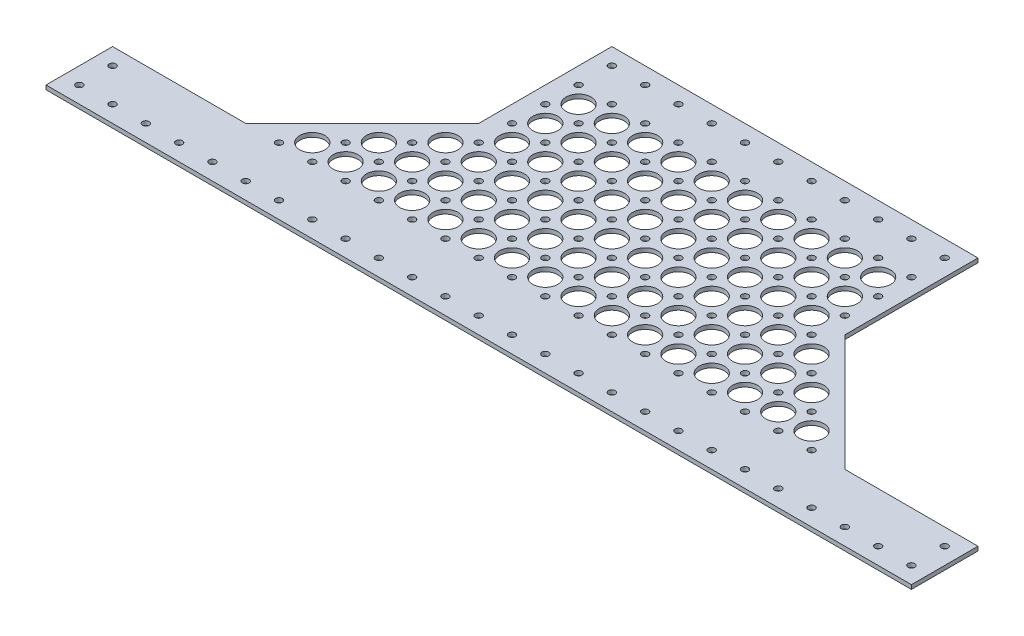
from build123d import *

# Parameters (mm, degrees)
SKETCH1_R           = 2.54
BOSS_EXTRUDE1_DEPTH = 3.175
SKETCH2_W           = 711.2
SKETCH2_H           = 25.4
CUT_EXTRUDE2_DEPTH  = 469.9
CUT_EXTRUDE3_START  = -3.175
SKETCH3_R           = 2.54
SKETCH3_R_2         = 9.525
CUT_EXTRUDE3_DEPTH  = 3.175


with BuildPart() as part:
    # Sketch1 → Boss-Extrude1 (new body)
    with BuildSketch(Plane(origin=(0, 0, 0), x_dir=(1, 0, 0), z_dir=(0, 1, 0))):
        Polygon((0, 101.6), (0, 0), (-88.904535599, -88.904535599), (-177.804535599, -88.904535599), (-190.504535599, -88.904535599), (-190.504535599, -419.104535599), (-177.804535599, -419.104535599), (-88.904535599, -419.104535599), (0, -508.009071197), (0, -609.609071197), (279.4, -609.609071197), (279.4, -508.009071197), (368.304535599, -419.104535599), (469.904535599, -419.104535599), (469.904535599, -88.904535599), (368.304535599, -88.904535599), (279.4, 0), (279.4, 101.6), align=None)
        with Locations((12.7, -596.909071197)):
            Circle(SKETCH1_R, mode=Mode.SUBTRACT)
        with Locations((38.1, -596.909071197)):
            Circle(SKETCH1_R, mode=Mode.SUBTRACT)
        with Locations((63.5, -596.909071197)):
            Circle(SKETCH1_R, mode=Mode.SUBTRACT)
        with Locations((88.9, -596.909071197)):
            Circle(SKETCH1_R, mode=Mode.SUBTRACT)
        with Locations((114.3, -596.909071197)):
            Circle(SKETCH1_R, mode=Mode.SUBTRACT)
        with Locations((139.7, -596.909071197)):
            Circle(SKETCH1_R, mode=Mode.SUBTRACT)
        with Locations((-177.804535599, -406.404535599)):
            Circle(SKETCH1_R, mode=Mode.SUBTRACT)
        with Locations((-152.404535599, -406.404535599)):
            Circle(SKETCH1_R, mode=Mode.SUBTRACT)
        with Locations((-127.004535599, -406.404535599)):
            Circle(SKETCH1_R, mode=Mode.SUBTRACT)
        with Locations((-177.804535599, -381.004535599)):
            Circle(SKETCH1_R, mode=Mode.SUBTRACT)
        with Locations((-152.404535599, -381.004535599)):
            Circle(SKETCH1_R, mode=Mode.SUBTRACT)
        with Locations((-177.804535599, -355.604535599)):
            Circle(SKETCH1_R, mode=Mode.SUBTRACT)
        with Locations((-127.004535599, -381.004535599)):
            Circle(SKETCH1_R, mode=Mode.SUBTRACT)
        with Locations((-101.604535599, -406.404535599)):
            Circle(SKETCH1_R, mode=Mode.SUBTRACT)
        with Locations((-101.604535599, -381.004535599)):
            Circle(SKETCH1_R, mode=Mode.SUBTRACT)
        with Locations((-177.804535599, -330.204535599)):
            Circle(SKETCH1_R, mode=Mode.SUBTRACT)
        with Locations((-177.804535599, -304.804535599)):
            Circle(SKETCH1_R, mode=Mode.SUBTRACT)
        with Locations((-177.804535599, -279.404535599)):
            Circle(SKETCH1_R, mode=Mode.SUBTRACT)
        with Locations((165.1, -596.909071197)):
            Circle(SKETCH1_R, mode=Mode.SUBTRACT)
        with Locations((190.5, -596.909071197)):
            Circle(SKETCH1_R, mode=Mode.SUBTRACT)
        with Locations((215.9, -596.909071197)):
            Circle(SKETCH1_R, mode=Mode.SUBTRACT)
        with Locations((241.3, -596.909071197)):
            Circle(SKETCH1_R, mode=Mode.SUBTRACT)
        with Locations((266.7, -596.909071197)):
            Circle(SKETCH1_R, mode=Mode.SUBTRACT)
        with Locations((381.004535599, -406.404535599)):
            Circle(SKETCH1_R, mode=Mode.SUBTRACT)
        with Locations((381.004535599, -381.004535599)):
            Circle(SKETCH1_R, mode=Mode.SUBTRACT)
        with Locations((406.404535599, -406.404535599)):
            Circle(SKETCH1_R, mode=Mode.SUBTRACT)
        with Locations((431.804535599, -406.404535599)):
            Circle(SKETCH1_R, mode=Mode.SUBTRACT)
        with Locations((457.204535599, -406.404535599)):
            Circle(SKETCH1_R, mode=Mode.SUBTRACT)
        with Locations((406.404535599, -381.004535599)):
            Circle(SKETCH1_R, mode=Mode.SUBTRACT)
        with Locations((431.804535599, -381.004535599)):
            Circle(SKETCH1_R, mode=Mode.SUBTRACT)
        with Locations((457.204535599, -381.004535599)):
            Circle(SKETCH1_R, mode=Mode.SUBTRACT)
        with Locations((457.204535599, -355.604535599)):
            Circle(SKETCH1_R, mode=Mode.SUBTRACT)
        with Locations((457.204535599, -330.204535599)):
            Circle(SKETCH1_R, mode=Mode.SUBTRACT)
        with Locations((457.204535599, -304.804535599)):
            Circle(SKETCH1_R, mode=Mode.SUBTRACT)
        with Locations((457.204535599, -279.404535599)):
            Circle(SKETCH1_R, mode=Mode.SUBTRACT)
        with Locations((-177.804535599, -254.004535599)):
            Circle(SKETCH1_R, mode=Mode.SUBTRACT)
        with Locations((-177.804535599, -228.604535599)):
            Circle(SKETCH1_R, mode=Mode.SUBTRACT)
        with Locations((-177.804535599, -203.204535599)):
            Circle(SKETCH1_R, mode=Mode.SUBTRACT)
        with Locations((-177.804535599, -177.804535599)):
            Circle(SKETCH1_R, mode=Mode.SUBTRACT)
        with Locations((-177.804535599, -152.404535599)):
            Circle(SKETCH1_R, mode=Mode.SUBTRACT)
        with Locations((-152.404535599, -152.404535599)):
            Circle(SKETCH1_R, mode=Mode.SUBTRACT)
        with Locations((-177.804535599, -127.004535599)):
            Circle(SKETCH1_R, mode=Mode.SUBTRACT)
        with Locations((-152.404535599, -127.004535599)):
            Circle(SKETCH1_R, mode=Mode.SUBTRACT)
        with Locations((-127.004535599, -152.404535599)):
            Circle(SKETCH1_R, mode=Mode.SUBTRACT)
        with Locations((-127.004535599, -127.004535599)):
            Circle(SKETCH1_R, mode=Mode.SUBTRACT)
        with Locations((-177.804535599, -101.604535599)):
            Circle(SKETCH1_R, mode=Mode.SUBTRACT)
        with Locations((-101.604535599, -152.404535599)):
            Circle(SKETCH1_R, mode=Mode.SUBTRACT)
        with Locations((-76.204535599, -152.404535599)):
            Circle(SKETCH1_R, mode=Mode.SUBTRACT)
        with Locations((-101.604535599, -127.004535599)):
            Circle(SKETCH1_R, mode=Mode.SUBTRACT)
        with Locations((-76.204535599, -127.004535599)):
            Circle(SKETCH1_R, mode=Mode.SUBTRACT)
        with Locations((-50.804535599, -152.404535599)):
            Circle(SKETCH1_R, mode=Mode.SUBTRACT)
        with Locations((-25.404535599, -152.404535599)):
            Circle(SKETCH1_R, mode=Mode.SUBTRACT)
        with Locations((-50.804535599, -127.004535599)):
            Circle(SKETCH1_R, mode=Mode.SUBTRACT)
        with Locations((-25.404535599, -127.004535599)):
            Circle(SKETCH1_R, mode=Mode.SUBTRACT)
        with Locations((-0.004535599, -152.404535599)):
            Circle(SKETCH1_R, mode=Mode.SUBTRACT)
        with Locations((-0.004535599, -127.004535599)):
            Circle(SKETCH1_R, mode=Mode.SUBTRACT)
        with Locations((25.395464401, -152.404535599)):
            Circle(SKETCH1_R, mode=Mode.SUBTRACT)
        with Locations((50.795464401, -152.404535599)):
            Circle(SKETCH1_R, mode=Mode.SUBTRACT)
        with Locations((25.395464401, -127.004535599)):
            Circle(SKETCH1_R, mode=Mode.SUBTRACT)
        with Locations((50.795464401, -127.004535599)):
            Circle(SKETCH1_R, mode=Mode.SUBTRACT)
        with Locations((76.195464401, -152.404535599)):
            Circle(SKETCH1_R, mode=Mode.SUBTRACT)
        with Locations((76.195464401, -127.004535599)):
            Circle(SKETCH1_R, mode=Mode.SUBTRACT)
        with Locations((101.595464401, -152.404535599)):
            Circle(SKETCH1_R, mode=Mode.SUBTRACT)
        with Locations((126.995464401, -152.404535599)):
            Circle(SKETCH1_R, mode=Mode.SUBTRACT)
        with Locations((101.595464401, -127.004535599)):
            Circle(SKETCH1_R, mode=Mode.SUBTRACT)
        with Locations((126.995464401, -127.004535599)):
            Circle(SKETCH1_R, mode=Mode.SUBTRACT)
        with Locations((12.7, 88.9)):
            Circle(SKETCH1_R, mode=Mode.SUBTRACT)
        with Locations((38.1, 88.9)):
            Circle(SKETCH1_R, mode=Mode.SUBTRACT)
        with Locations((63.5, 88.9)):
            Circle(SKETCH1_R, mode=Mode.SUBTRACT)
        with Locations((88.9, 88.9)):
            Circle(SKETCH1_R, mode=Mode.SUBTRACT)
        with Locations((114.3, 88.9)):
            Circle(SKETCH1_R, mode=Mode.SUBTRACT)
        with Locations((139.7, 88.9)):
            Circle(SKETCH1_R, mode=Mode.SUBTRACT)
        with Locations((152.395464401, -152.404535599)):
            Circle(SKETCH1_R, mode=Mode.SUBTRACT)
        with Locations((177.795464401, -152.404535599)):
            Circle(SKETCH1_R, mode=Mode.SUBTRACT)
        with Locations((152.395464401, -127.004535599)):
            Circle(SKETCH1_R, mode=Mode.SUBTRACT)
        with Locations((177.795464401, -127.004535599)):
            Circle(SKETCH1_R, mode=Mode.SUBTRACT)
        with Locations((203.195464401, -152.404535599)):
            Circle(SKETCH1_R, mode=Mode.SUBTRACT)
        with Locations((203.195464401, -127.004535599)):
            Circle(SKETCH1_R, mode=Mode.SUBTRACT)
        with Locations((228.595464401, -152.404535599)):
            Circle(SKETCH1_R, mode=Mode.SUBTRACT)
        with Locations((253.995464401, -152.404535599)):
            Circle(SKETCH1_R, mode=Mode.SUBTRACT)
        with Locations((228.595464401, -127.004535599)):
            Circle(SKETCH1_R, mode=Mode.SUBTRACT)
        with Locations((253.995464401, -127.004535599)):
            Circle(SKETCH1_R, mode=Mode.SUBTRACT)
        with Locations((279.395464401, -152.404535599)):
            Circle(SKETCH1_R, mode=Mode.SUBTRACT)
        with Locations((304.795464401, -152.404535599)):
            Circle(SKETCH1_R, mode=Mode.SUBTRACT)
        with Locations((279.395464401, -127.004535599)):
            Circle(SKETCH1_R, mode=Mode.SUBTRACT)
        with Locations((304.795464401, -127.004535599)):
            Circle(SKETCH1_R, mode=Mode.SUBTRACT)
        with Locations((457.204535599, -254.004535599)):
            Circle(SKETCH1_R, mode=Mode.SUBTRACT)
        with Locations((457.204535599, -228.604535599)):
            Circle(SKETCH1_R, mode=Mode.SUBTRACT)
        with Locations((457.204535599, -203.204535599)):
            Circle(SKETCH1_R, mode=Mode.SUBTRACT)
        with Locations((457.204535599, -177.804535599)):
            Circle(SKETCH1_R, mode=Mode.SUBTRACT)
        with Locations((330.195464401, -152.404535599)):
            Circle(SKETCH1_R, mode=Mode.SUBTRACT)
        with Locations((330.195464401, -127.004535599)):
            Circle(SKETCH1_R, mode=Mode.SUBTRACT)
        with Locations((355.595464401, -152.404535599)):
            Circle(SKETCH1_R, mode=Mode.SUBTRACT)
        with Locations((380.995464401, -152.404535599)):
            Circle(SKETCH1_R, mode=Mode.SUBTRACT)
        with Locations((355.595464401, -127.004535599)):
            Circle(SKETCH1_R, mode=Mode.SUBTRACT)
        with Locations((380.995464401, -127.004535599)):
            Circle(SKETCH1_R, mode=Mode.SUBTRACT)
        with Locations((406.395464401, -152.404535599)):
            Circle(SKETCH1_R, mode=Mode.SUBTRACT)
        with Locations((406.395464401, -127.004535599)):
            Circle(SKETCH1_R, mode=Mode.SUBTRACT)
        with Locations((431.795464401, -152.404535599)):
            Circle(SKETCH1_R, mode=Mode.SUBTRACT)
        with Locations((457.204535599, -152.404535599)):
            Circle(SKETCH1_R, mode=Mode.SUBTRACT)
        with Locations((431.795464401, -127.004535599)):
            Circle(SKETCH1_R, mode=Mode.SUBTRACT)
        with Locations((457.204535599, -127.004535599)):
            Circle(SKETCH1_R, mode=Mode.SUBTRACT)
        with Locations((457.204535599, -101.604535599)):
            Circle(SKETCH1_R, mode=Mode.SUBTRACT)
        with Locations((165.1, 88.9)):
            Circle(SKETCH1_R, mode=Mode.SUBTRACT)
        with Locations((190.5, 88.9)):
            Circle(SKETCH1_R, mode=Mode.SUBTRACT)
        with Locations((215.9, 88.9)):
            Circle(SKETCH1_R, mode=Mode.SUBTRACT)
        with Locations((241.3, 88.9)):
            Circle(SKETCH1_R, mode=Mode.SUBTRACT)
        with Locations((266.7, 88.9)):
            Circle(SKETCH1_R, mode=Mode.SUBTRACT)
    extrude(amount=BOSS_EXTRUDE1_DEPTH)

    # Sketch2 → Cut-Extrude2 (cut)
    with BuildSketch(Plane.XY.offset(609.609071197)):
        with Locations((152.586714342, 0)):
            Rectangle(SKETCH2_W, SKETCH2_H)
    extrude(amount=-CUT_EXTRUDE2_DEPTH, mode=Mode.SUBTRACT)

    # Sketch3 → Cut-Extrude3 (cut)
    with BuildSketch(Plane(origin=(0, 3.175, 0), x_dir=(1, 0, 0), z_dir=(0, 1, 0)).offset(CUT_EXTRUDE3_START)):
        with Locations((12.7, 88.9)):
            Circle(SKETCH3_R)
        with Locations((38.1, 88.9)):
            Circle(SKETCH3_R)
        with Locations((63.5, 88.9)):
            Circle(SKETCH3_R)
        with Locations((88.9, 88.9)):
            Circle(SKETCH3_R)
        with Locations((114.3, 88.9)):
            Circle(SKETCH3_R)
        with Locations((139.7, 88.9)):
            Circle(SKETCH3_R)
        with Locations((165.1, 88.9)):
            Circle(SKETCH3_R)
        with Locations((190.5, 88.9)):
            Circle(SKETCH3_R)
        with Locations((215.9, 88.9)):
            Circle(SKETCH3_R)
        with Locations((241.3, 88.9)):
            Circle(SKETCH3_R)
        with Locations((266.7, 88.9)):
            Circle(SKETCH3_R)
        with Locations((12.7, 63.5)):
            Circle(SKETCH3_R)
        with Locations((38.1, 63.5)):
            Circle(SKETCH3_R)
        with Locations((63.5, 63.5)):
            Circle(SKETCH3_R)
        with Locations((88.9, 63.5)):
            Circle(SKETCH3_R)
        with Locations((114.3, 63.5)):
            Circle(SKETCH3_R)
        with Locations((139.7, 63.5)):
            Circle(SKETCH3_R)
        with Locations((165.1, 63.5)):
            Circle(SKETCH3_R)
        with Locations((190.5, 63.5)):
            Circle(SKETCH3_R)
        with Locations((215.9, 63.5)):
            Circle(SKETCH3_R)
        with Locations((241.3, 63.5)):
            Circle(SKETCH3_R)
        with Locations((266.7, 63.5)):
            Circle(SKETCH3_R)
        with Locations((12.7, 38.1)):
            Circle(SKETCH3_R)
        with Locations((38.1, 38.1)):
            Circle(SKETCH3_R)
        with Locations((63.5, 38.1)):
            Circle(SKETCH3_R)
        with Locations((88.9, 38.1)):
            Circle(SKETCH3_R)
        with Locations((114.3, 38.1)):
            Circle(SKETCH3_R)
        with Locations((139.7, 38.1)):
            Circle(SKETCH3_R)
        with Locations((165.1, 38.1)):
            Circle(SKETCH3_R)
        with Locations((190.5, 38.1)):
            Circle(SKETCH3_R)
        with Locations((215.9, 38.1)):
            Circle(SKETCH3_R)
        with Locations((241.3, 38.1)):
            Circle(SKETCH3_R)
        with Locations((266.7, 38.1)):
            Circle(SKETCH3_R)
        with Locations((12.7, 12.7)):
            Circle(SKETCH3_R)
        with Locations((38.1, 12.7)):
            Circle(SKETCH3_R)
        with Locations((63.5, 12.7)):
            Circle(SKETCH3_R)
        with Locations((88.9, 12.7)):
            Circle(SKETCH3_R)
        with Locations((114.3, 12.7)):
            Circle(SKETCH3_R)
        with Locations((139.7, 12.7)):
            Circle(SKETCH3_R)
        with Locations((165.1, 12.7)):
            Circle(SKETCH3_R)
        with Locations((190.5, 12.7)):
            Circle(SKETCH3_R)
        with Locations((215.9, 12.7)):
            Circle(SKETCH3_R)
        with Locations((241.3, 12.7)):
            Circle(SKETCH3_R)
        with Locations((266.7, 12.7)):
            Circle(SKETCH3_R)
        with Locations((12.7, -12.7)):
            Circle(SKETCH3_R)
        with Locations((38.1, -12.7)):
            Circle(SKETCH3_R)
        with Locations((63.5, -12.7)):
            Circle(SKETCH3_R)
        with Locations((88.9, -12.7)):
            Circle(SKETCH3_R)
        with Locations((114.3, -12.7)):
            Circle(SKETCH3_R)
        with Locations((139.7, -12.7)):
            Circle(SKETCH3_R)
        with Locations((165.1, -12.7)):
            Circle(SKETCH3_R)
        with Locations((190.5, -12.7)):
            Circle(SKETCH3_R)
        with Locations((215.9, -12.7)):
            Circle(SKETCH3_R)
        with Locations((241.3, -12.7)):
            Circle(SKETCH3_R)
        with Locations((266.7, -12.7)):
            Circle(SKETCH3_R)
        with Locations((12.7, -38.1)):
            Circle(SKETCH3_R)
        with Locations((38.1, -38.1)):
            Circle(SKETCH3_R)
        with Locations((63.5, -38.1)):
            Circle(SKETCH3_R)
        with Locations((88.9, -38.1)):
            Circle(SKETCH3_R)
        with Locations((114.3, -38.1)):
            Circle(SKETCH3_R)
        with Locations((139.7, -38.1)):
            Circle(SKETCH3_R)
        with Locations((165.1, -38.1)):
            Circle(SKETCH3_R)
        with Locations((190.5, -38.1)):
            Circle(SKETCH3_R)
        with Locations((215.9, -38.1)):
            Circle(SKETCH3_R)
        with Locations((241.3, -38.1)):
            Circle(SKETCH3_R)
        with Locations((266.7, -38.1)):
            Circle(SKETCH3_R)
        with Locations((12.7, -63.5)):
            Circle(SKETCH3_R)
        with Locations((38.1, -63.5)):
            Circle(SKETCH3_R)
        with Locations((63.5, -63.5)):
            Circle(SKETCH3_R)
        with Locations((88.9, -63.5)):
            Circle(SKETCH3_R)
        with Locations((114.3, -63.5)):
            Circle(SKETCH3_R)
        with Locations((139.7, -63.5)):
            Circle(SKETCH3_R)
        with Locations((165.1, -63.5)):
            Circle(SKETCH3_R)
        with Locations((190.5, -63.5)):
            Circle(SKETCH3_R)
        with Locations((215.9, -63.5)):
            Circle(SKETCH3_R)
        with Locations((241.3, -63.5)):
            Circle(SKETCH3_R)
        with Locations((266.7, -63.5)):
            Circle(SKETCH3_R)
        with Locations((12.7, -88.9)):
            Circle(SKETCH3_R)
        with Locations((38.1, -88.9)):
            Circle(SKETCH3_R)
        with Locations((63.5, -88.9)):
            Circle(SKETCH3_R)
        with Locations((88.9, -88.9)):
            Circle(SKETCH3_R)
        with Locations((114.3, -88.9)):
            Circle(SKETCH3_R)
        with Locations((139.7, -88.9)):
            Circle(SKETCH3_R)
        with Locations((165.1, -88.9)):
            Circle(SKETCH3_R)
        with Locations((190.5, -88.9)):
            Circle(SKETCH3_R)
        with Locations((215.9, -88.9)):
            Circle(SKETCH3_R)
        with Locations((241.3, -88.9)):
            Circle(SKETCH3_R)
        with Locations((266.7, -88.9)):
            Circle(SKETCH3_R)
        with Locations((-12.7, -88.9)):
            Circle(SKETCH3_R)
        with Locations((-38.1, -88.9)):
            Circle(SKETCH3_R)
        with Locations((-63.5, -88.9)):
            Circle(SKETCH3_R)
        with Locations((-12.7, -63.5)):
            Circle(SKETCH3_R)
        with Locations((-38.1, -63.5)):
            Circle(SKETCH3_R)
        with Locations((-12.7, -38.1)):
            Circle(SKETCH3_R)
        with Locations((292.1, -88.9)):
            Circle(SKETCH3_R)
        with Locations((317.5, -88.9)):
            Circle(SKETCH3_R)
        with Locations((342.9, -88.9)):
            Circle(SKETCH3_R)
        with Locations((292.1, -63.5)):
            Circle(SKETCH3_R)
        with Locations((317.5, -63.5)):
            Circle(SKETCH3_R)
        with Locations((292.1, -38.1)):
            Circle(SKETCH3_R)
        with Locations((25.4, 50.8)):
            Circle(SKETCH3_R_2)
        with Locations((50.8, 50.8)):
            Circle(SKETCH3_R_2)
        with Locations((76.2, 50.8)):
            Circle(SKETCH3_R_2)
        with Locations((101.6, 50.8)):
            Circle(SKETCH3_R_2)
        with Locations((127, 50.8)):
            Circle(SKETCH3_R_2)
        with Locations((152.4, 50.8)):
            Circle(SKETCH3_R_2)
        with Locations((177.8, 50.8)):
            Circle(SKETCH3_R_2)
        with Locations((203.2, 50.8)):
            Circle(SKETCH3_R_2)
        with Locations((228.6, 50.8)):
            Circle(SKETCH3_R_2)
        with Locations((254, 50.8)):
            Circle(SKETCH3_R_2)
        with Locations((50.8, 25.4)):
            Circle(SKETCH3_R_2)
        with Locations((76.2, 25.4)):
            Circle(SKETCH3_R_2)
        with Locations((101.6, 25.4)):
            Circle(SKETCH3_R_2)
        with Locations((127, 25.4)):
            Circle(SKETCH3_R_2)
        with Locations((152.4, 25.4)):
            Circle(SKETCH3_R_2)
        with Locations((177.8, 25.4)):
            Circle(SKETCH3_R_2)
        with Locations((203.2, 25.4)):
            Circle(SKETCH3_R_2)
        with Locations((228.6, 25.4)):
            Circle(SKETCH3_R_2)
        with Locations((254, 25.4)):
            Circle(SKETCH3_R_2)
        with Locations((50.8, 0)):
            Circle(SKETCH3_R_2)
        with Locations((76.2, 0)):
            Circle(SKETCH3_R_2)
        with Locations((101.6, 0)):
            Circle(SKETCH3_R_2)
        with Locations((127, 0)):
            Circle(SKETCH3_R_2)
        with Locations((152.4, 0)):
            Circle(SKETCH3_R_2)
        with Locations((177.8, 0)):
            Circle(SKETCH3_R_2)
        with Locations((203.2, 0)):
            Circle(SKETCH3_R_2)
        with Locations((228.6, 0)):
            Circle(SKETCH3_R_2)
        with Locations((254, 0)):
            Circle(SKETCH3_R_2)
        with Locations((50.8, -25.4)):
            Circle(SKETCH3_R_2)
        with Locations((76.2, -25.4)):
            Circle(SKETCH3_R_2)
        with Locations((101.6, -25.4)):
            Circle(SKETCH3_R_2)
        with Locations((127, -25.4)):
            Circle(SKETCH3_R_2)
        with Locations((152.4, -25.4)):
            Circle(SKETCH3_R_2)
        with Locations((177.8, -25.4)):
            Circle(SKETCH3_R_2)
        with Locations((203.2, -25.4)):
            Circle(SKETCH3_R_2)
        with Locations((228.6, -25.4)):
            Circle(SKETCH3_R_2)
        with Locations((254, -25.4)):
            Circle(SKETCH3_R_2)
        with Locations((279.4, -25.4)):
            Circle(SKETCH3_R_2)
        with Locations((50.8, -50.8)):
            Circle(SKETCH3_R_2)
        with Locations((76.2, -50.8)):
            Circle(SKETCH3_R_2)
        with Locations((101.6, -50.8)):
            Circle(SKETCH3_R_2)
        with Locations((127, -50.8)):
            Circle(SKETCH3_R_2)
        with Locations((152.4, -50.8)):
            Circle(SKETCH3_R_2)
        with Locations((177.8, -50.8)):
            Circle(SKETCH3_R_2)
        with Locations((203.2, -50.8)):
            Circle(SKETCH3_R_2)
        with Locations((228.6, -50.8)):
            Circle(SKETCH3_R_2)
        with Locations((254, -50.8)):
            Circle(SKETCH3_R_2)
        with Locations((279.4, -50.8)):
            Circle(SKETCH3_R_2)
        with Locations((304.8, -50.8)):
            Circle(SKETCH3_R_2)
        with Locations((50.8, -76.2)):
            Circle(SKETCH3_R_2)
        with Locations((76.2, -76.2)):
            Circle(SKETCH3_R_2)
        with Locations((101.6, -76.2)):
            Circle(SKETCH3_R_2)
        with Locations((127, -76.2)):
            Circle(SKETCH3_R_2)
        with Locations((152.4, -76.2)):
            Circle(SKETCH3_R_2)
        with Locations((177.8, -76.2)):
            Circle(SKETCH3_R_2)
        with Locations((203.2, -76.2)):
            Circle(SKETCH3_R_2)
        with Locations((228.6, -76.2)):
            Circle(SKETCH3_R_2)
        with Locations((254, -76.2)):
            Circle(SKETCH3_R_2)
        with Locations((279.4, -76.2)):
            Circle(SKETCH3_R_2)
        with Locations((304.8, -76.2)):
            Circle(SKETCH3_R_2)
        with Locations((330.2, -76.2)):
            Circle(SKETCH3_R_2)
        with Locations((25.4, 25.4)):
            Circle(SKETCH3_R_2)
        with Locations((25.4, 0)):
            Circle(SKETCH3_R_2)
        with Locations((25.4, -25.4)):
            Circle(SKETCH3_R_2)
        with Locations((25.4, -50.8)):
            Circle(SKETCH3_R_2)
        with Locations((25.4, -76.2)):
            Circle(SKETCH3_R_2)
        with Locations((0, -25.4)):
            Circle(SKETCH3_R_2)
        with Locations((0, -50.8)):
            Circle(SKETCH3_R_2)
        with Locations((0, -76.2)):
            Circle(SKETCH3_R_2)
        with Locations((-25.4, -50.8)):
            Circle(SKETCH3_R_2)
        with Locations((-25.4, -76.2)):
            Circle(SKETCH3_R_2)
        with Locations((-50.8, -76.2)):
            Circle(SKETCH3_R_2)
    extrude(amount=CUT_EXTRUDE3_DEPTH, mode=Mode.SUBTRACT)


solid = part.part
